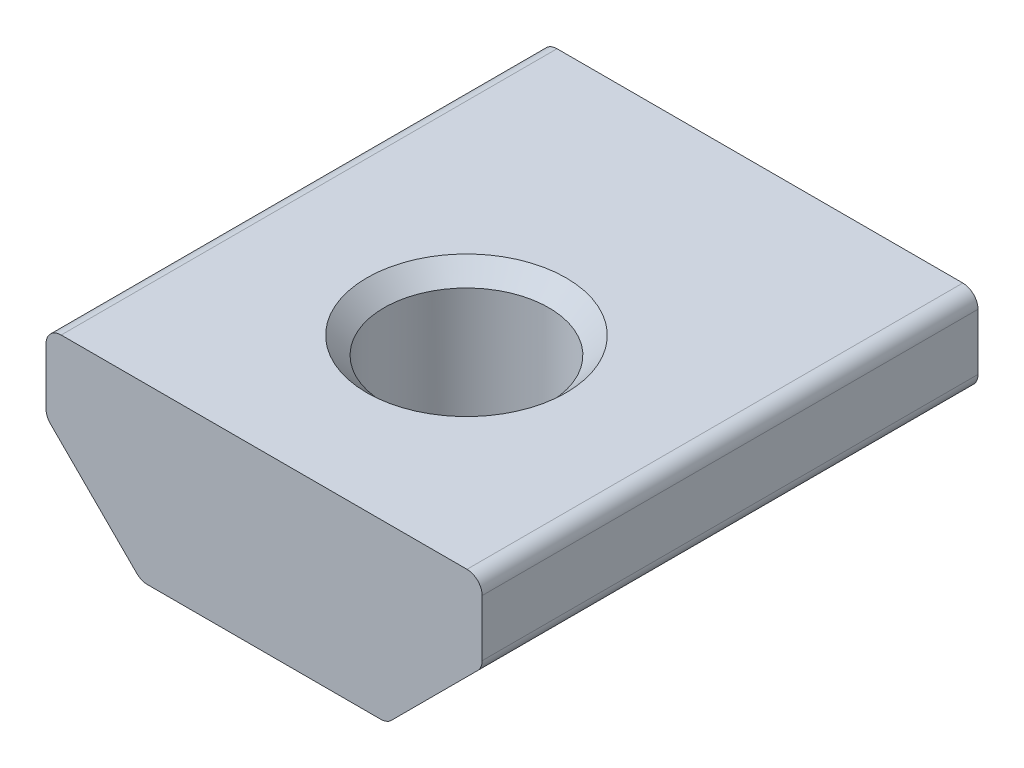
from build123d import *

# Parameters (mm, degrees)
BOSS_EXTRUDE1_DEPTH   = 12.446
F_6_CLEARANCE_HOLE1_D = 4.134
CHAMFER1_SIZE         = 0.433
FILLET1_R             = 0.381


with BuildPart() as part:
    # Sketch1 → Boss-Extrude1 (new body)
    with BuildSketch(Plane.XY.offset(5.08)):
        Polygon((5.4737, 4.3434), (-5.4737, 4.3434), (-5.4737, 2.38887), (-3.08483, 0), (3.08483, 0), (5.4737, 2.38887), align=None)
    extrude(amount=-BOSS_EXTRUDE1_DEPTH)

    # #6 Clearance Hole1 (through all)
    with Locations(Plane(origin=(0, 4.3434, 0), x_dir=(1, 0, 0), z_dir=(0, 1, 0))):
        with Locations((0, 0)):
            Hole(F_6_CLEARANCE_HOLE1_D / 2)

    # Chamfer1
    chamfer1_edges = [part.edges().sort_by_distance(p)[0] for p in [
        (2.067, 0, 0),
        (2.067, 4.3434, 0),
    ]]
    chamfer(chamfer1_edges, length=CHAMFER1_SIZE)

    # Fillet1
    fillet1_edges = [part.edges().sort_by_distance(p)[0] for p in [
        (-3.08483, 0, -1.143),
        (-5.4737, 4.3434, -1.143),
        (-5.4737, 2.38887, -1.143),
        (5.4737, 4.3434, -1.143),
        (3.08483, 0, -1.143),
        (5.4737, 2.38887, -1.143),
    ]]
    fillet(fillet1_edges, radius=FILLET1_R)


solid = part.part
